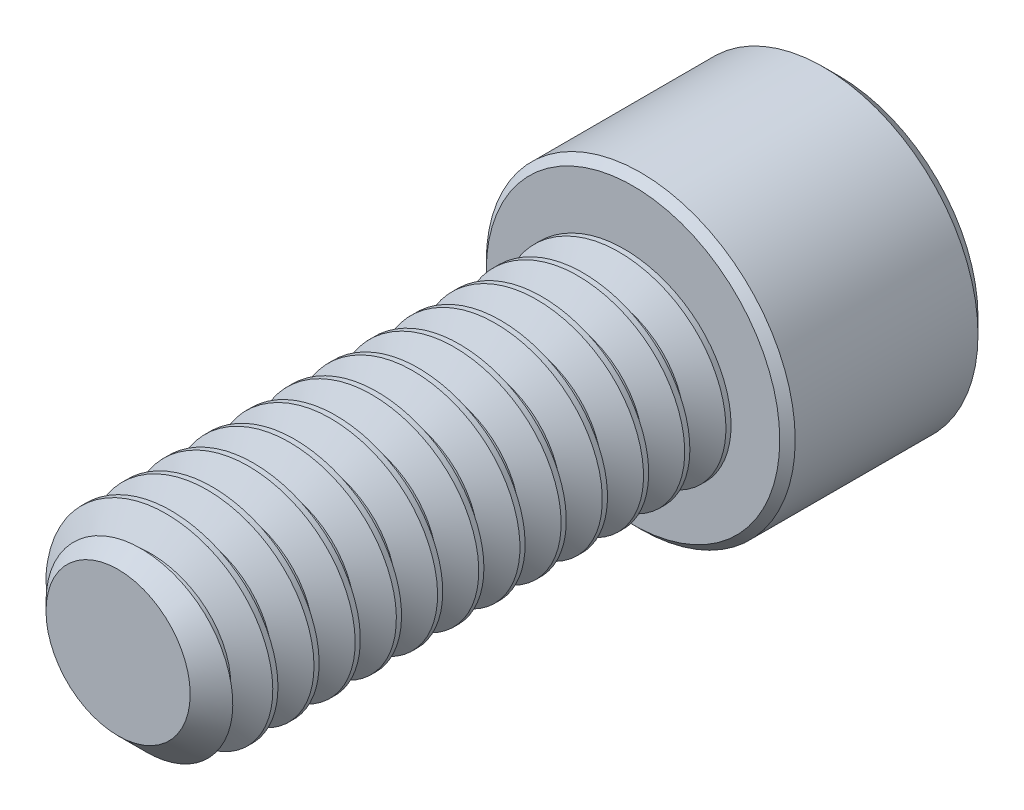
from build123d import *

# Parameters (mm, degrees)
SKETCH1_R          = 3.175
EXTRUDE1_DEPTH     = 15.875
CHAMFER3_SIZE      = 0.9525
CUT_SWEEP1_PITCH   = 1.27
SKETCH6_R          = 4.7625
EXTRUDE2_DEPTH     = 6.35
CUT_EXTRUDE1_DEPTH = 3.571875
CHAMFER1_SIZE      = 0.47625
CHAMFER2_SIZE      = 0.238125


with BuildPart() as part:
    # Sketch1 → Extrude1 (new body)
    with BuildSketch(Plane.XY):
        Circle(SKETCH1_R)
    extrude(amount=-EXTRUDE1_DEPTH)

    # Chamfer3
    chamfer3_edges = [part.edges().sort_by_distance(p)[0] for p in [
        (-3.175, 0, 0),
    ]]
    chamfer(chamfer3_edges, length=CHAMFER3_SIZE)

    # Cut-Sweep1: the profile of Sketch3 profile screwed along a right-hand helix of 13.5 turns, 6 arcs to a turn; built about Z, then put on its axis
    cut_sweep1_z = Axis((0, 0, 0), (0, 0, 1))
    cut_sweep1_corners = [(3.1753, 0, -1.111423205), (2.350110803, 0, -0.635), (2.350110803, 0, -0.47625), (3.1753, 0, 0.000173205)]
    with BuildLine(mode=Mode.PRIVATE) as cut_sweep1_profile:
        Line(cut_sweep1_corners[0], cut_sweep1_corners[1])
        Line(cut_sweep1_corners[1], cut_sweep1_corners[2])
        Line(cut_sweep1_corners[2], cut_sweep1_corners[3])
        Line(cut_sweep1_corners[3], cut_sweep1_corners[0])
    cut_sweep1_cap = Face(cut_sweep1_profile.wire())
    cut_sweep1_turn_angles = [0, 30, 60, 90, 120, 150, 180, 210, 240, 270, 300, 330, 360]
    cut_sweep1_turn_weights = [1, 0.8660254037844387, 1, 0.8660254037844387, 1, 0.8660254037844387, 1, 0.8660254037844387, 1, 0.8660254037844387, 1, 0.8660254037844387, 1]
    cut_sweep1_turn_rails = [Edge.make_bspline([Vector(p[0], p[1], 0).rotate(cut_sweep1_z, cut_sweep1_turn_angles[k]) / cut_sweep1_turn_weights[k] + Vector(0, 0, p[2] + CUT_SWEEP1_PITCH * cut_sweep1_turn_angles[k] / 360) for k in range(13)], [0, 0, 0, 1, 1, 2, 2, 3, 3, 4, 4, 5, 5, 6, 6, 6], 2, cut_sweep1_turn_weights) for p in cut_sweep1_corners]
    cut_sweep1_turn_sides = [Face.make_surface_from_curves(cut_sweep1_turn_rails[p[0]], cut_sweep1_turn_rails[p[1]]) for p in [(0, 1), (1, 2), (2, 3), (3, 0)]]
    cut_sweep1_last_angles = [4680, 4710, 4740, 4770, 4800, 4830, 4860]
    cut_sweep1_last_weights = [1, 0.8660254037844387, 1, 0.8660254037844387, 1, 0.8660254037843712, 1]
    cut_sweep1_last_rails = [Edge.make_bspline([Vector(p[0], p[1], 0).rotate(cut_sweep1_z, cut_sweep1_last_angles[k]) / cut_sweep1_last_weights[k] + Vector(0, 0, p[2] + CUT_SWEEP1_PITCH * cut_sweep1_last_angles[k] / 360) for k in range(7)], [0, 0, 0, 1, 1, 2, 2, 3, 3, 3], 2, cut_sweep1_last_weights) for p in cut_sweep1_corners]
    cut_sweep1_last_sides = [Face.make_surface_from_curves(cut_sweep1_last_rails[p[0]], cut_sweep1_last_rails[p[1]]) for p in [(0, 1), (1, 2), (2, 3), (3, 0)]]
    cut_sweep1 = Plane(origin=(0, 0, 0), x_dir=(0, 1, 0), z_dir=(0, 0, -1)) * Solid(Shell([*[p.moved(Location((0, 0, CUT_SWEEP1_PITCH * i))) for i in range(13) for p in cut_sweep1_turn_sides], *cut_sweep1_last_sides, cut_sweep1_cap, cut_sweep1_cap.rotate(cut_sweep1_z, 4860).moved(Location((0, 0, CUT_SWEEP1_PITCH * 4860 / 360)))]))
    add(cut_sweep1, mode=Mode.SUBTRACT)

    # Sketch6 → Extrude2 (add)
    with BuildSketch(Plane(origin=(0, 0, -15.875), x_dir=(-1, 0, 0), z_dir=(0, 0, -1))):
        Circle(SKETCH6_R)
    extrude(amount=EXTRUDE2_DEPTH)

    # Sketch7 → Cut-Extrude1 (cut)
    with BuildSketch(Plane(origin=(0, 0, -22.225), x_dir=(-1, 0, 0), z_dir=(0, 0, -1))):
        Polygon((0, 2.749630657), (-2.38125, 1.374815329), (-2.38125, -1.374815329), (0, -2.749630657), (2.38125, -1.374815329), (2.38125, 1.374815329), align=None)
    extrude(amount=-CUT_EXTRUDE1_DEPTH, mode=Mode.SUBTRACT)

    # Cut-Extrude2 cone 1 section (through the dimple's axis) → Cut-Extrude2 (revolve, cut)
    with BuildSketch(Plane(origin=(0, 0, -22.225), x_dir=(0, 1, 0), z_dir=(1, 0, 0))):
        Polygon((0, 0), (2.749630657, 0), (0, 2.749630657), align=None)
    revolve(axis=Axis((0, 0, -22.225), (0, 0, 1)), mode=Mode.SUBTRACT)

    # Chamfer1
    chamfer1_edges = [part.edges().sort_by_distance(p)[0] for p in [
        (4.7625, 0, -22.225),
    ]]
    chamfer(chamfer1_edges, length=CHAMFER1_SIZE)

    # Chamfer2
    chamfer2_edges = [part.edges().sort_by_distance(p)[0] for p in [
        (4.7625, 0, -15.875),
    ]]
    chamfer(chamfer2_edges, length=CHAMFER2_SIZE)


solid = part.part
